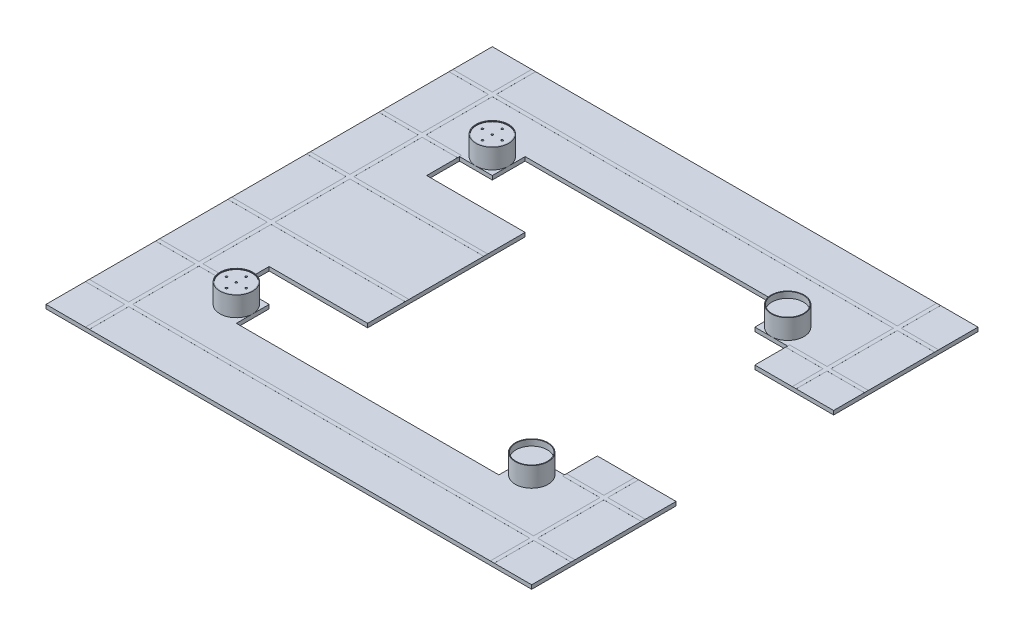
from build123d import *

# Parameters (mm, degrees)
SKETCH1_W               = 3700
SKETCH1_H               = 3400
SKETCH1_W_2             = 2500
SKETCH1_H_2             = 500
SKETCH1_W_3             = 250
SKETCH1_H_3             = 250
BOSS_EXTRUDE1_DEPTH     = 30
BOSS_EXTRUDE2_DEPTH     = 600
SKETCH3_R               = 125
BOSS_EXTRUDE3_DEPTH     = 150
SKETCH4_R               = 120
CUT_EXTRUDE1_DEPTH      = 5
SKETCH5_R               = 7.5
CUT_EXTRUDE2_DEPTH      = 20
MIRROR3_COPY_1_SKETCH_R = 125
MIRROR3_COPY_1_DEPTH    = 150
MIRROR3_COPY_2_SKETCH_R = 120
MIRROR3_COPY_2_DEPTH    = 5
MIRROR3_COPY_3_SKETCH_R = 7.5
MIRROR3_COPY_3_DEPTH    = 20
SKETCH6_R               = 120
CUT_EXTRUDE3_DEPTH      = 40
SKETCH7_W               = 300
SKETCH7_H               = 300
BOSS_EXTRUDE4_DEPTH     = 0.1
SKETCH8_W               = 3700
SKETCH8_H               = 30
SKETCH8_W_2             = 30
SKETCH8_H_2             = 3400
SKETCH8_W_3             = 600
SKETCH8_W_4             = 2350
EXTRUDE_THIN1_DEPTH     = 0.2
SKETCH9_W               = 230.740107676
SKETCH9_H               = 30
EXTRUDE_THIN2_DEPTH     = 0.1
SKETCH10_W              = 600
SKETCH10_H              = 30
EXTRUDE_THIN3_DEPTH     = 0.1
SKETCH11_R              = 21
BOSS_EXTRUDE5_DEPTH     = 350
SPLIT3_SURFACE_1_BACK   = 5040.286
SPLIT3_SURFACE_1_DEPTH  = 10080.572
SPLIT3_SURFACE_2_BACK   = 5040.286
SPLIT3_SURFACE_2_DEPTH  = 10080.572
SAVE_START              = -600
SAVE_BODIES1_DEPTH      = 1200
SPLIT5_SURFACE_3_BACK   = 5040.286
SPLIT5_SURFACE_3_DEPTH  = 10080.572
SPLIT5_SURFACE_4_BACK   = 5040.286
SPLIT5_SURFACE_4_DEPTH  = 10080.572
SAVE_BODIES2_OUTLINE_W  = 1350
SAVE_BODIES2_OUTLINE_H  = 1200
SAVE_BODIES2_DEPTH      = 380


# Read off the part's stored shape, not the designer's step: Save Bodies1, Save Bodies2
with BuildPart() as part:
    # Sketch1 → Boss-Extrude1 (new body)
    # profile 1 of 5: a face of its own
    with BuildSketch(Plane(origin=(0, 0, 0), x_dir=(1, 0, 0), z_dir=(0, 1, 0))):
        Rectangle(SKETCH1_W, SKETCH1_H)
        with Locations((0, 850)):
            Rectangle(SKETCH1_W_2, SKETCH1_H_2, mode=Mode.SUBTRACT)
        with Locations((0, -850)):
            Rectangle(SKETCH1_W_2, SKETCH1_H_2, mode=Mode.SUBTRACT)
    # profile 2 of 5: a face of its own
    with BuildSketch(Plane(origin=(0, 0, 0), x_dir=(1, 0, 0), z_dir=(0, 1, 0))):
        with Locations((-1125, 975)):
            Rectangle(SKETCH1_W_3, SKETCH1_H_3)
    # profile 3 of 5: a face of its own
    with BuildSketch(Plane(origin=(0, 0, 0), x_dir=(1, 0, 0), z_dir=(0, 1, 0))):
        with Locations((1125, 975)):
            Rectangle(SKETCH1_W_3, SKETCH1_H_3)
    # profile 4 of 5: a face of its own
    with BuildSketch(Plane(origin=(0, 0, 0), x_dir=(1, 0, 0), z_dir=(0, 1, 0))):
        with Locations((1125, -975)):
            Rectangle(SKETCH1_W_3, SKETCH1_H_3)
    # profile 5 of 5: a face of its own
    with BuildSketch(Plane(origin=(0, 0, 0), x_dir=(1, 0, 0), z_dir=(0, 1, 0))):
        with Locations((-1125, -975)):
            Rectangle(SKETCH1_W_3, SKETCH1_H_3)
    extrude(amount=BOSS_EXTRUDE1_DEPTH)

    # Sketch2 → Boss-Extrude2 (add, symmetric)
    with BuildSketch(Plane.XY):
        Polygon((-500, 30), (-300, 145.470053838), (300, 145.470053838), (500, 30), align=None)
    extrude(amount=BOSS_EXTRUDE2_DEPTH, both=True)

    # Sketch3 → Boss-Extrude3 (add)
    with BuildSketch(Plane(origin=(0, 30, 0), x_dir=(1, 0, 0), z_dir=(0, 1, 0))):
        with Locations(Location((-1125, 975, 0), (0, 0, 270))):
            Circle(SKETCH3_R)
    boss_extrude3 = extrude(amount=BOSS_EXTRUDE3_DEPTH)

    # Sketch4 → Cut-Extrude1 (cut)
    with BuildSketch(Plane(origin=(0, 180, 0), x_dir=(1, 0, 0), z_dir=(0, 1, 0))):
        with Locations(Location((-1125, 975, 0), (0, 0, 270))):
            Circle(SKETCH4_R)
    cut_extrude1 = extrude(amount=-CUT_EXTRUDE1_DEPTH, mode=Mode.SUBTRACT)

    # Sketch5 → Cut-Extrude2 (cut)
    with BuildSketch(Plane(origin=(0, 175, 0), x_dir=(1, 0, 0), z_dir=(0, 1, 0))):
        with Locations(Location((-1125, 975, 0), (0, 0, 270))):
            Circle(SKETCH5_R)
        with Locations(Location((-1050, 975, 0), (0, 0, 270))):
            Circle(SKETCH5_R)
        with Locations(Location((-1125, 900, 0), (0, 0, 270))):
            Circle(SKETCH5_R)
        with Locations(Location((-1200, 975, 0), (0, 0, 270))):
            Circle(SKETCH5_R)
        with Locations(Location((-1125, 1050, 0), (0, 0, 270))):
            Circle(SKETCH5_R)
    cut_extrude2 = extrude(amount=-CUT_EXTRUDE2_DEPTH, mode=Mode.SUBTRACT)

    # Mirror2: Boss-Extrude3, Cut-Extrude1, Cut-Extrude2 across plane
    add(boss_extrude3.mirror(Plane.XY))
    add(cut_extrude1.mirror(Plane.XY), mode=Mode.SUBTRACT)
    add(cut_extrude2.mirror(Plane.XY), mode=Mode.SUBTRACT)

    # Mirror3: Boss-Extrude3, Cut-Extrude1, Cut-Extrude2 across plane
    add(boss_extrude3.mirror(Plane(origin=(0, 0, 0), x_dir=(0, 0, 1), z_dir=(1, 0, 0))))
    add(cut_extrude1.mirror(Plane(origin=(0, 0, 0), x_dir=(0, 0, 1), z_dir=(1, 0, 0))), mode=Mode.SUBTRACT)
    add(cut_extrude2.mirror(Plane(origin=(0, 0, 0), x_dir=(0, 0, 1), z_dir=(1, 0, 0))), mode=Mode.SUBTRACT)

    # Mirror3 copy 1 sketch → Mirror3 copy 1 (add)
    with BuildSketch(Plane(origin=(0, 30, 0), x_dir=(-1, 0, 0), z_dir=(0, 1, 0))):
        with Locations(Location((-1125, 975, 0), (0, 0, 270))):
            Circle(MIRROR3_COPY_1_SKETCH_R)
    extrude(amount=MIRROR3_COPY_1_DEPTH)

    # Mirror3 copy 2 sketch → Mirror3 copy 2 (cut)
    with BuildSketch(Plane(origin=(0, 180, 0), x_dir=(-1, 0, 0), z_dir=(0, 1, 0))):
        with Locations(Location((-1125, 975, 0), (0, 0, 270))):
            Circle(MIRROR3_COPY_2_SKETCH_R)
    extrude(amount=-MIRROR3_COPY_2_DEPTH, mode=Mode.SUBTRACT)

    # Mirror3 copy 3 sketch → Mirror3 copy 3 (cut)
    with BuildSketch(Plane(origin=(0, 175, 0), x_dir=(-1, 0, 0), z_dir=(0, 1, 0))):
        with Locations(Location((-1125, 975, 0), (0, 0, 270))):
            Circle(MIRROR3_COPY_3_SKETCH_R)
        with Locations(Location((-1050, 975, 0), (0, 0, 270))):
            Circle(MIRROR3_COPY_3_SKETCH_R)
        with Locations(Location((-1125, 900, 0), (0, 0, 270))):
            Circle(MIRROR3_COPY_3_SKETCH_R)
        with Locations(Location((-1200, 975, 0), (0, 0, 270))):
            Circle(MIRROR3_COPY_3_SKETCH_R)
        with Locations(Location((-1125, 1050, 0), (0, 0, 270))):
            Circle(MIRROR3_COPY_3_SKETCH_R)
    extrude(amount=-MIRROR3_COPY_3_DEPTH, mode=Mode.SUBTRACT)

    # Sketch6 → Cut-Extrude3 (cut)
    with BuildSketch(Plane(origin=(0, 175, 0), x_dir=(1, 0, 0), z_dir=(0, 1, 0))):
        with Locations(Location((1125, 975, 0), (0, 0, 270))):
            Circle(SKETCH6_R)
    cut_extrude3 = extrude(amount=-CUT_EXTRUDE3_DEPTH, mode=Mode.SUBTRACT)

    # Mirror4: Cut-Extrude3 across plane
    add(cut_extrude3.mirror(Plane.XY), mode=Mode.SUBTRACT)

    # Sketch7 → Boss-Extrude4 (add)
    with BuildSketch(Plane(origin=(0, 30, 0), x_dir=(1, 0, 0), z_dir=(0, 1, 0))):
        with Locations((-1700, 1550)):
            Rectangle(SKETCH7_W, SKETCH7_H)
        with Locations((-1700, -1550)):
            Rectangle(SKETCH7_W, SKETCH7_H)
    extrude(amount=BOSS_EXTRUDE4_DEPTH)

    # Sketch8 → Extrude-Thin1 (add)
    with BuildSketch(Plane(origin=(0, 30, 0), x_dir=(1, 0, 0), z_dir=(0, 1, 0))):
        with Locations((0, 1385)):
            Rectangle(SKETCH8_W, SKETCH8_H)
        with Locations((-1535, 0)):
            Rectangle(SKETCH8_W_2, SKETCH8_H_2)
        with Locations((1550, 0)):
            Rectangle(SKETCH8_W_2, SKETCH8_H_2)
        with Locations((-1550, 850)):
            Rectangle(SKETCH8_W_3, SKETCH8_H)
        with Locations((-675, 300)):
            Rectangle(SKETCH8_W_4, SKETCH8_H)
        with Locations((-675, -300)):
            Rectangle(SKETCH8_W_4, SKETCH8_H)
        with Locations((0, -1385)):
            Rectangle(SKETCH8_W, SKETCH8_H)
        with Locations((-1550, -850)):
            Rectangle(SKETCH8_W_3, SKETCH8_H)
        with Locations((1550, 850)):
            Rectangle(SKETCH8_W_3, SKETCH8_H)
        with Locations((1550, -850)):
            Rectangle(SKETCH8_W_3, SKETCH8_H)
    extrude(amount=EXTRUDE_THIN1_DEPTH)

    # Sketch9 → Extrude-Thin2 (add)
    with BuildSketch(Plane(origin=(-137.990381057, 239.006350946, 0), x_dir=(0.8660254037844415, 0.4999999999999951, 0), z_dir=(-0.49999999999999517, 0.8660254037844416, 0))):
        with Locations((-302.442648054, 300)):
            Rectangle(SKETCH9_W, SKETCH9_H)
        with Locations((-302.442648054, -300)):
            Rectangle(SKETCH9_W, SKETCH9_H)
    extrude_thin2 = extrude(amount=EXTRUDE_THIN2_DEPTH)

    # Sketch10 → Extrude-Thin3 (add)
    with BuildSketch(Plane(origin=(0, 145.470053838, 0), x_dir=(1, 0, 0), z_dir=(0, 1, 0))):
        with Locations((0, 300)):
            Rectangle(SKETCH10_W, SKETCH10_H)
        with Locations((0, -300)):
            Rectangle(SKETCH10_W, SKETCH10_H)
    extrude(amount=EXTRUDE_THIN3_DEPTH)

    # Mirror5: Extrude-Thin2 across plane
    add(extrude_thin2.mirror(Plane(origin=(0, 0, 0), x_dir=(0, 0, 1), z_dir=(1, 0, 0))))

    # Sketch11 → Boss-Extrude5 (add)
    with BuildSketch(Plane(origin=(0, 30, 0), x_dir=(1, 0, 0), z_dir=(0, 1, 0))):
        with Locations(Location((850, -298.836957303, 0), (0, 0, 270))):
            Circle(SKETCH11_R)
        with Locations(Location((1050, -448.836957303, 0), (0, 0, 270))):
            Circle(SKETCH11_R)
        with Locations(Location((1450, -298.836957303, 0), (0, 0, 270))):
            Circle(SKETCH11_R)
        with Locations(Location((1250, -148.836957303, 0), (0, 0, 270))):
            Circle(SKETCH11_R)
    boss_extrude5 = extrude(amount=BOSS_EXTRUDE5_DEPTH)

    # Mirror6: Boss-Extrude5 across plane
    add(boss_extrude5.mirror(Plane.XY))


with BuildPart() as body_2:
    # Split3: the piece behind the surface
    add(part.part)
    # Split3 surface: a surface, the sketch's curves swept straight by 10080.572 mm
    with BuildLine(Plane(origin=(0, 30, 0), x_dir=(1, 0, 0), z_dir=(0, 1, 0)).offset(-SPLIT3_SURFACE_1_BACK), mode=Mode.PRIVATE) as split3_surface_1_path:
        Line((500, -600), (-500, -600))
        Line((-500, -600), (-500, 600))
        Line((-500, 600), (500, 600))
        Line((500, 600), (500, -600))
    split3_surface_1 = Shell.extrude(split3_surface_1_path.wire(), (0 * SPLIT3_SURFACE_1_DEPTH, 1 * SPLIT3_SURFACE_1_DEPTH, 0 * SPLIT3_SURFACE_1_DEPTH))
    split(bisect_by=split3_surface_1, keep=Keep.BOTTOM)

    # Save Bodies1 outline → Save Bodies1 (cut)
    with BuildSketch(Plane.XY.offset(SAVE_START)):
        Polygon((500, 30.2), (499.853589838, 30.2), (300.05, 145.556656378), (300, 145.470053838), (300, 145.570053838), (-300, 145.570053838), (-300, 145.470053838), (-300.05, 145.556656378), (-499.853589838, 30.2), (-500, 30.2), (-500, 0), (500, 0), align=None)
    extrude(amount=SAVE_BODIES1_DEPTH, mode=Mode.SUBTRACT)


with BuildPart() as part_1:
    add(part.part)

    # Split3: split by a surface, the side it looks to stays
    # Split3 surface: a surface, the sketch's curves swept straight by 10080.572 mm
    with BuildLine(Plane(origin=(0, 30, 0), x_dir=(1, 0, 0), z_dir=(0, 1, 0)).offset(-SPLIT3_SURFACE_2_BACK), mode=Mode.PRIVATE) as split3_surface_2_path:
        Line((500, -600), (-500, -600))
        Line((-500, -600), (-500, 600))
        Line((-500, 600), (500, 600))
        Line((500, 600), (500, -600))
    split3_surface_2 = Shell.extrude(split3_surface_2_path.wire(), (0 * SPLIT3_SURFACE_2_DEPTH, 1 * SPLIT3_SURFACE_2_DEPTH, 0 * SPLIT3_SURFACE_2_DEPTH))
    split(bisect_by=split3_surface_2, keep=Keep.TOP)


with BuildPart() as body_2_2:
    # Split5: the piece behind the surface
    add(part_1.part)
    # Split5 surface: a surface, the sketch's curves swept straight by 10080.572 mm
    with BuildLine(Plane(origin=(0, 30, 0), x_dir=(1, 0, 0), z_dir=(0, 1, 0)).offset(-SPLIT5_SURFACE_3_BACK), mode=Mode.PRIVATE) as split5_surface_3_path:
        Line((500, 600), (1850, 600))
        Line((1850, 600), (1850, -600))
        Line((1850, -600), (500, -600))
        Line((500, -600), (500, 600))
    split5_surface_3 = Shell.extrude(split5_surface_3_path.wire(), (0 * SPLIT5_SURFACE_3_DEPTH, 1 * SPLIT5_SURFACE_3_DEPTH, 0 * SPLIT5_SURFACE_3_DEPTH))
    split(bisect_by=split5_surface_3, keep=Keep.BOTTOM)

    # Save Bodies2 outline → Save Bodies2 (cut)
    with BuildSketch(Plane(origin=(0, 0, 0), x_dir=(1, 0, 0), z_dir=(0, 1, 0))):
        with Locations((1175, 0)):
            Rectangle(SAVE_BODIES2_OUTLINE_W, SAVE_BODIES2_OUTLINE_H)
    extrude(amount=SAVE_BODIES2_DEPTH, mode=Mode.SUBTRACT)


with BuildPart() as part_2:
    add(part_1.part)

    # Split5: split by a surface, the side it looks to stays
    # Split5 surface: a surface, the sketch's curves swept straight by 10080.572 mm
    with BuildLine(Plane(origin=(0, 30, 0), x_dir=(1, 0, 0), z_dir=(0, 1, 0)).offset(-SPLIT5_SURFACE_4_BACK), mode=Mode.PRIVATE) as split5_surface_4_path:
        Line((500, 600), (1850, 600))
        Line((1850, 600), (1850, -600))
        Line((1850, -600), (500, -600))
        Line((500, -600), (500, 600))
    split5_surface_4 = Shell.extrude(split5_surface_4_path.wire(), (0 * SPLIT5_SURFACE_4_DEPTH, 1 * SPLIT5_SURFACE_4_DEPTH, 0 * SPLIT5_SURFACE_4_DEPTH))
    split(bisect_by=split5_surface_4, keep=Keep.TOP)


solid = part_2.part
